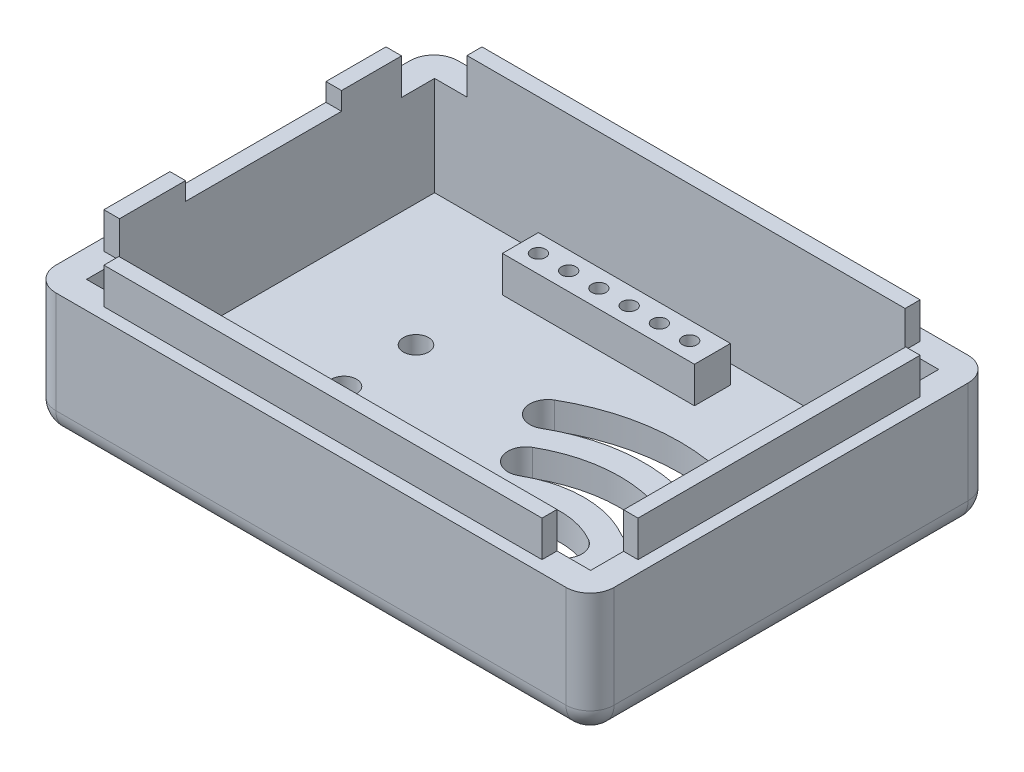
from build123d import *

# Parameters (mm, degrees)
SKETCH1_W               = 46.5
SKETCH1_H               = 33.5
BOSS_EXTRUDE1_DEPTH     = 13.5
SKETCH2_W               = 42
SKETCH2_H               = 29
CUT_EXTRUDE1_DEPTH      = 11.25
FILLET1_R               = 2
SKETCH4_R               = 1.05
CUT_EXTRUDE2_DEPTH      = 11.25
SKETCH5_W               = 7
SKETCH5_H               = 4.5
CUT_EXTRUDE3_DEPTH      = 11.25
SKETCH6_R               = 1.5
CUT_EXTRUDE4_DEPTH      = 11.25
SKETCH7_R               = 1
CUT_EXTRUDE5_DEPTH      = 11.25
SKETCH8_W               = 16
SKETCH8_H               = 3
BOSS_EXTRUDE2_DEPTH     = 3
SKETCH9_R               = 0.6
CUT_EXTRUDE6_DEPTH      = 3
LPATTERN1_COUNT         = 6
LPATTERN1_PITCH         = 2.52
MIRROR1_COPY_1_SKETCH_R = 0.6
MIRROR1_COPY_1_DEPTH    = 3
MIRROR1_COPY_2_SKETCH_R = 0.6
MIRROR1_COPY_2_DEPTH    = 3
MIRROR1_COPY_3_SKETCH_R = 0.6
MIRROR1_COPY_3_DEPTH    = 3
MIRROR1_COPY_4_SKETCH_R = 0.6
MIRROR1_COPY_4_DEPTH    = 3
MIRROR1_COPY_5_SKETCH_R = 0.6
MIRROR1_COPY_5_DEPTH    = 3
SKETCH11_W              = 48.5
SKETCH11_H              = 35.5
SKETCH11_W_2            = 44.5
SKETCH11_H_2            = 31.5
CUT_EXTRUDE7_DEPTH      = 3
SKETCH12_W              = 4
SKETCH12_H              = 13
CUT_EXTRUDE8_DEPTH      = 1.5
SKETCH13_W              = 10
SKETCH13_H              = 10
CUT_EXTRUDE9_DEPTH      = 3
FILLET2_R               = 3


with BuildPart() as part:
    # Sketch1 → Boss-Extrude1 (new body)
    with BuildSketch(Plane(origin=(0, 0, 0), x_dir=(1, 0, 0), z_dir=(0, 1, 0))):
        with Locations((-23.25, 16.75)):
            Rectangle(SKETCH1_W, SKETCH1_H)
    extrude(amount=BOSS_EXTRUDE1_DEPTH)

    # Sketch2 → Cut-Extrude1 (cut)
    with BuildSketch(Plane(origin=(0, 13.5, 0), x_dir=(1, 0, 0), z_dir=(0, 1, 0))):
        with Locations((-23.2, 16.75)):
            Rectangle(SKETCH2_W, SKETCH2_H)
    extrude(amount=-CUT_EXTRUDE1_DEPTH, mode=Mode.SUBTRACT)

    # Fillet1
    fillet1_edges = [part.edges().sort_by_distance(p)[0] for p in [
        (-46.5, 6.75, 0),
        (-46.5, 6.75, -33.5),
        (0, 6.75, -33.5),
        (0, 6.75, 0),
        (-46.5, 0, -16.75),
        (-23.25, 0, -33.5),
        (0, 0, -16.75),
        (-23.25, 0, 0),
    ]]
    fillet(fillet1_edges, radius=FILLET1_R)

    # Sketch4 → Cut-Extrude2 (cut)
    with BuildSketch(Plane(origin=(0, 2.25, 0), x_dir=(1, 0, 0), z_dir=(0, 1, 0))):
        with Locations((-34, 19.5)):
            Circle(SKETCH4_R)
        with Locations((-34, 13.5)):
            Circle(SKETCH4_R)
    extrude(amount=-CUT_EXTRUDE2_DEPTH, mode=Mode.SUBTRACT)

    # Sketch5 → Cut-Extrude3 (cut)
    with BuildSketch(Plane(origin=(0, 2.25, 0), x_dir=(1, 0, 0), z_dir=(0, 1, 0))):
        with Locations((-37.5, 5.75)):
            Rectangle(SKETCH5_W, SKETCH5_H)
    extrude(amount=-CUT_EXTRUDE3_DEPTH, mode=Mode.SUBTRACT)

    # Sketch6 → Cut-Extrude4 (cut)
    with BuildSketch(Plane(origin=(0, 2.25, 0), x_dir=(1, 0, 0), z_dir=(0, 1, 0))):
        with BuildLine():
            ThreePointArc((-19.25, 12.629165125), (-19.799038106, 10.580127019), (-17.75, 10.031088913))
            ThreePointArc((-17.75, 10.031088913), (-16, 10.5), (-14.25, 10.031088913))
            ThreePointArc((-14.25, 10.031088913), (-12.200961894, 10.580127019), (-12.75, 12.629165125))
            ThreePointArc((-12.75, 12.629165125), (-16, 13.5), (-19.25, 12.629165125))
        make_face()
        with Locations((-16, 7)):
            Circle(SKETCH6_R)
        with BuildLine():
            ThreePointArc((-21.75, 16.959292144), (-22.299038106, 14.910254038), (-20.25, 14.361215932))
            ThreePointArc((-20.25, 14.361215932), (-16, 15.5), (-11.75, 14.361215932))
            ThreePointArc((-11.75, 14.361215932), (-9.700961894, 14.910254038), (-10.25, 16.959292144))
            ThreePointArc((-10.25, 16.959292144), (-16, 18.5), (-21.75, 16.959292144))
        make_face()
        with BuildLine():
            ThreePointArc((-24.25, 21.289419162), (-24.799038106, 19.240381057), (-22.75, 18.691342951))
            ThreePointArc((-22.75, 18.691342951), (-16, 20.5), (-9.25, 18.691342951))
            ThreePointArc((-9.25, 18.691342951), (-7.200961894, 19.240381057), (-7.75, 21.289419162))
            ThreePointArc((-7.75, 21.289419162), (-16, 23.5), (-24.25, 21.289419162))
        make_face()
    extrude(amount=-CUT_EXTRUDE4_DEPTH, mode=Mode.SUBTRACT)

    # Sketch7 → Cut-Extrude5 (cut)
    with BuildSketch(Plane(origin=(0, 2.25, 0), x_dir=(1, 0, 0), z_dir=(0, 1, 0))):
        with Locations((-40.25, 8)):
            Circle(SKETCH7_R)
    extrude(amount=-CUT_EXTRUDE5_DEPTH, mode=Mode.SUBTRACT)

    # Sketch8 → Boss-Extrude2 (add)
    with BuildSketch(Plane(origin=(0, 2.25, 0), x_dir=(1, 0, 0), z_dir=(0, 1, 0))):
        with Locations((-26, 5.3)):
            Rectangle(SKETCH8_W, SKETCH8_H)
    boss_extrude2 = extrude(amount=BOSS_EXTRUDE2_DEPTH)

    # Sketch9 → Cut-Extrude6 (cut)
    with BuildSketch(Plane(origin=(0, 5.25, 0), x_dir=(1, 0, 0), z_dir=(0, 1, 0))):
        with Locations((-32.5, 5.3)):
            Circle(SKETCH9_R)
    cut_extrude6 = extrude(amount=-CUT_EXTRUDE6_DEPTH, mode=Mode.SUBTRACT)

    # LPattern1: Cut-Extrude6 ×6
    with Locations(*[(i * LPATTERN1_PITCH, 0, 0) for i in range(1, LPATTERN1_COUNT)]):
        add(cut_extrude6, mode=Mode.SUBTRACT)

    # Mirror1: Boss-Extrude2, Cut-Extrude6 across plane
    add(boss_extrude2.mirror(Plane.XY.offset(-16.75)))
    add(cut_extrude6.mirror(Plane.XY.offset(-16.75)), mode=Mode.SUBTRACT)

    # Mirror1 copy 1 sketch → Mirror1 copy 1 (cut)
    with BuildSketch(Plane(origin=(2.52, 5.25, -33.5), x_dir=(1, 0, 0), z_dir=(0, 1, 0))):
        with Locations((-32.5, -5.3)):
            Circle(MIRROR1_COPY_1_SKETCH_R)
    extrude(amount=-MIRROR1_COPY_1_DEPTH, mode=Mode.SUBTRACT)

    # Mirror1 copy 2 sketch → Mirror1 copy 2 (cut)
    with BuildSketch(Plane(origin=(5.04, 5.25, -33.5), x_dir=(1, 0, 0), z_dir=(0, 1, 0))):
        with Locations((-32.5, -5.3)):
            Circle(MIRROR1_COPY_2_SKETCH_R)
    extrude(amount=-MIRROR1_COPY_2_DEPTH, mode=Mode.SUBTRACT)

    # Mirror1 copy 3 sketch → Mirror1 copy 3 (cut)
    with BuildSketch(Plane(origin=(7.56, 5.25, -33.5), x_dir=(1, 0, 0), z_dir=(0, 1, 0))):
        with Locations((-32.5, -5.3)):
            Circle(MIRROR1_COPY_3_SKETCH_R)
    extrude(amount=-MIRROR1_COPY_3_DEPTH, mode=Mode.SUBTRACT)

    # Mirror1 copy 4 sketch → Mirror1 copy 4 (cut)
    with BuildSketch(Plane(origin=(10.08, 5.25, -33.5), x_dir=(1, 0, 0), z_dir=(0, 1, 0))):
        with Locations((-32.5, -5.3)):
            Circle(MIRROR1_COPY_4_SKETCH_R)
    extrude(amount=-MIRROR1_COPY_4_DEPTH, mode=Mode.SUBTRACT)

    # Mirror1 copy 5 sketch → Mirror1 copy 5 (cut)
    with BuildSketch(Plane(origin=(12.6, 5.25, -33.5), x_dir=(1, 0, 0), z_dir=(0, 1, 0))):
        with Locations((-32.5, -5.3)):
            Circle(MIRROR1_COPY_5_SKETCH_R)
    extrude(amount=-MIRROR1_COPY_5_DEPTH, mode=Mode.SUBTRACT)

    # Sketch11 → Cut-Extrude7 (cut)
    with BuildSketch(Plane(origin=(0, 13.5, 0), x_dir=(1, 0, 0), z_dir=(0, 1, 0))):
        with Locations((-23.25, 16.75)):
            Rectangle(SKETCH11_W, SKETCH11_H)
        with Locations((-23.25, 16.75)):
            Rectangle(SKETCH11_W_2, SKETCH11_H_2, mode=Mode.SUBTRACT)
    extrude(amount=-CUT_EXTRUDE7_DEPTH, mode=Mode.SUBTRACT)

    # Sketch12 → Cut-Extrude8 (cut)
    with BuildSketch(Plane(origin=(0, 13.5, 0), x_dir=(1, 0, 0), z_dir=(0, 1, 0))):
        with Locations((-45, 17)):
            Rectangle(SKETCH12_W, SKETCH12_H)
    extrude(amount=-CUT_EXTRUDE8_DEPTH, mode=Mode.SUBTRACT)

    # Sketch13 → Cut-Extrude9 (cut)
    with BuildSketch(Plane(origin=(0, 13.5, 0), x_dir=(1, 0, 0), z_dir=(0, 1, 0))):
        Rectangle(SKETCH13_W, SKETCH13_H)
        with Locations((0, 33.5)):
            Rectangle(SKETCH13_W, SKETCH13_H)
        with Locations((-46.5, 33.5)):
            Rectangle(SKETCH13_W, SKETCH13_H)
        with Locations((-46.5, 0)):
            Rectangle(SKETCH13_W, SKETCH13_H)
    extrude(amount=-CUT_EXTRUDE9_DEPTH, mode=Mode.SUBTRACT)

    # Fillet2
    fillet2_edges = [part.edges().sort_by_distance(p)[0] for p in [
        (-41, 1.125, -7.338562172),
        (-39.25, 1.125, -8),
    ]]
    fillet(fillet2_edges, radius=FILLET2_R)


solid = part.part
